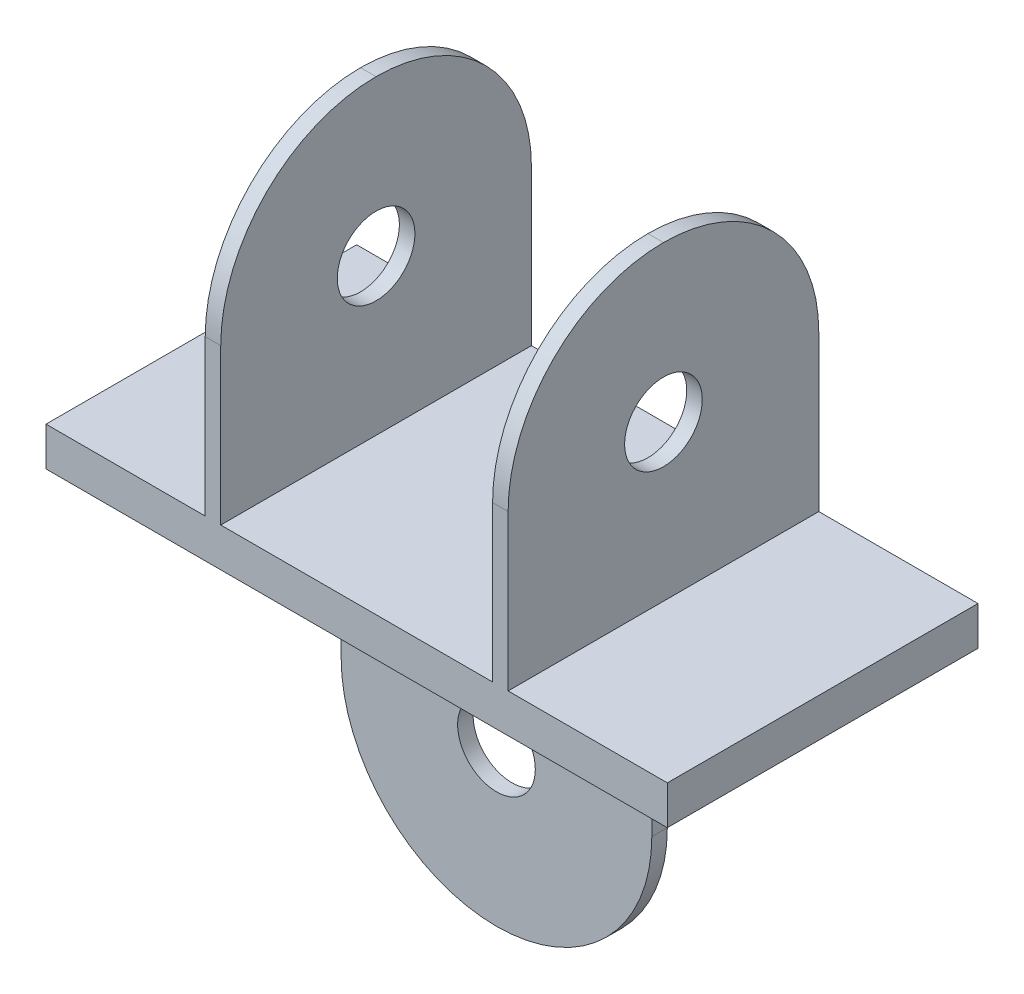
from build123d import *

# Parameters (mm, degrees)
BOSS_EXTRUDE1_DEPTH = 2
SKETCH4_W           = 80
SKETCH4_H           = 5
BOSS_EXTRUDE2_DEPTH = 20
SKETCH5_W           = 2
SKETCH5_H           = 40
BOSS_EXTRUDE3_DEPTH = 40
FILLET1_R           = 20
SKETCH6_R           = 5
CUT_EXTRUDE1_DEPTH  = 80
SKETCH7_R           = 5
CUT_EXTRUDE2_DEPTH  = 80


with BuildPart() as part:
    # Sketch3 → Boss-Extrude1 (new body)
    with BuildSketch(Plane.XY):
        with BuildLine():
            Line((-20, 0), (20, 0))
            Line((20, 0), (20, -20))
            ThreePointArc((20, -20), (0, -40), (-20, -20))
            Line((-20, -20), (-20, 0))
        make_face()
    extrude(amount=BOSS_EXTRUDE1_DEPTH)

    # Sketch4 → Boss-Extrude2 (add, symmetric)
    with BuildSketch(Plane.XY):
        with Locations((0, 2.5)):
            Rectangle(SKETCH4_W, SKETCH4_H)
    extrude(amount=BOSS_EXTRUDE2_DEPTH, both=True)

    # Sketch5 → Boss-Extrude3 (add)
    with BuildSketch(Plane(origin=(0, 5, 0), x_dir=(1, 0, 0), z_dir=(0, 1, 0))):
        with Locations((-18.5, 0)):
            Rectangle(SKETCH5_W, SKETCH5_H)
        with Locations((18.5, 0)):
            Rectangle(SKETCH5_W, SKETCH5_H)
    extrude(amount=BOSS_EXTRUDE3_DEPTH)

    # Fillet1
    fillet1_edges = [part.edges().sort_by_distance(p)[0] for p in [
        (-18.5, 45, -20),
        (18.5, 45, -20),
        (-18.5, 45, 20),
        (18.5, 45, 20),
    ]]
    fillet(fillet1_edges, radius=FILLET1_R - 0.0001)  # a hair under: the kernel refuses the full size

    # Sketch6 → Cut-Extrude1 (cut)
    with BuildSketch(Plane.ZY.offset(19.5)):
        with Locations(Location((0, 25, 0), (0, 0, 270))):
            Circle(SKETCH6_R)
    extrude(amount=-CUT_EXTRUDE1_DEPTH, mode=Mode.SUBTRACT)

    # Sketch7 → Cut-Extrude2 (cut)
    with BuildSketch(Plane.XY.offset(2)):
        with Locations((0, -20)):
            Circle(SKETCH7_R)
    extrude(amount=-CUT_EXTRUDE2_DEPTH, mode=Mode.SUBTRACT)


solid = part.part
